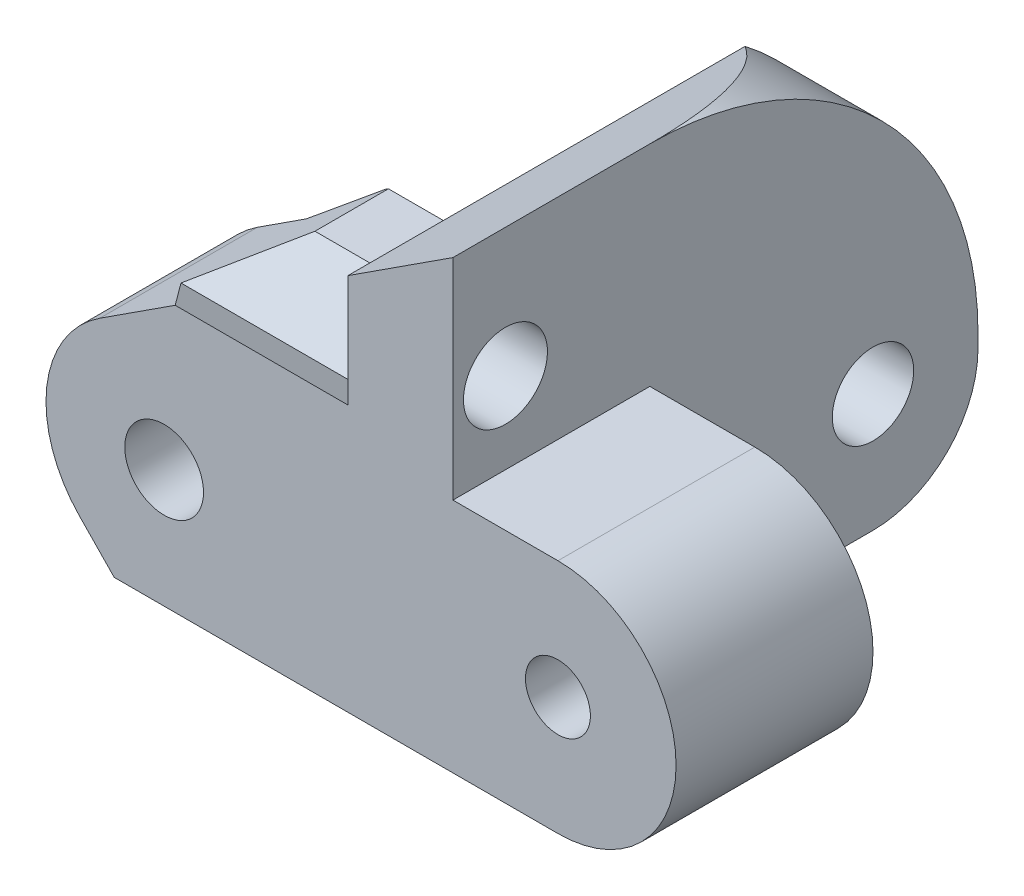
from build123d import *

# Parameters (mm, degrees)
SKETCH1_R           = 1.5
SKETCH1_R_2         = 1.236773622
BOSS_EXTRUDE1_DEPTH = 20
SKETCH3_R           = 1.6
CUT_EXTRUDE3_DEPTH  = 29.222331583
CUT_EXTRUDE4_DEPTH  = 14
CUT_EXTRUDE5_START  = -4
CUT_EXTRUDE5_DEPTH  = 25.222331583
SKETCH6_W           = 8.5
SKETCH6_H           = 9
SKETCH6_W_2         = 10
SKETCH6_H_2         = 10.541154273
CUT_EXTRUDE6_DEPTH  = 12.5
CHAMFER2_SIZE       = 2.5
CUT_EXTRUDE7_DEPTH  = 4.5
SKETCH8_R           = 1.55
CUT_EXTRUDE8_DEPTH  = 28.427176304
FILLET1_R           = 4
CHAMFER4_SIZE       = 1.8


with BuildPart() as part:
    # Sketch1 → Boss-Extrude1 (new body)
    with BuildSketch(Plane.XY):
        with BuildLine():
            Line((11, 12.5), (-2.4490752, 3.775186176))
            ThreePointArc((-2.4490752, 3.775186176), (-4.471750095, 0.503439255), (-3.227167472, -3.136142553))
            Line((-3.227167472, -3.136142553), (-1.901778748, -4.5))
            Line((-1.901778748, -4.5), (15, -4.5))
            ThreePointArc((15, -4.5), (19.5, 0), (15, 4.5))
            Line((15, 4.5), (11, 4.5))
            Line((11, 4.5), (11, 12.5))
        make_face()
        Circle(SKETCH1_R, mode=Mode.SUBTRACT)
        with Locations((15, 0)):
            Circle(SKETCH1_R_2, mode=Mode.SUBTRACT)
    extrude(amount=BOSS_EXTRUDE1_DEPTH)

    # Sketch3 → Cut-Extrude3 (cut, through all)
    with BuildSketch(Plane(origin=(11, 0, 0), x_dir=(0, 0, -1), z_dir=(1, 0, 0))):
        with Locations(Location((-18, 7.6, 0), (0, 0, 90))):
            Circle(SKETCH3_R)
    extrude(amount=-CUT_EXTRUDE3_DEPTH, mode=Mode.SUBTRACT)

    # Sketch4 → Cut-Extrude4 (cut)
    with BuildSketch(Plane(origin=(0, 0, 0), x_dir=(-1, 0, 0), z_dir=(0, 0, -1))):
        Polygon((1.58771324, 2.75), (1.58771324, 5.862379977), (6.597571209, 5.862379977), (6.597571209, -6.099785374), (1.58771324, -6.099785374), (1.58771324, -2.75), (-1.58771324, -2.75), (-3.175426481, 0), (-1.58771324, 2.75), align=None)
    extrude(amount=-CUT_EXTRUDE4_DEPTH, mode=Mode.SUBTRACT)

    # Sketch5 → Cut-Extrude5 (cut, through all)
    with BuildSketch(Plane(origin=(11, 0, 0), x_dir=(0, 0, -1), z_dir=(1, 0, 0)).offset(CUT_EXTRUDE5_START)):
        Polygon((-15.3, 6.041154273), (0, 6.041154273), (0, 11.349742261), (-20, 11.872391992), (-20, 5.637009085), (-18, 4.482308546), align=None)
    extrude(amount=-CUT_EXTRUDE5_DEPTH, mode=Mode.SUBTRACT)

    # Sketch6 → Cut-Extrude6 (cut)
    with BuildSketch(Plane(origin=(0, 0, 0), x_dir=(-1, 0, 0), z_dir=(0, 0, -1))):
        with Locations((-15.25, 0)):
            Rectangle(SKETCH6_W, SKETCH6_H)
        with Locations((-0.5, 0.770577137)):
            Rectangle(SKETCH6_W_2, SKETCH6_H_2)
    extrude(amount=-CUT_EXTRUDE6_DEPTH, mode=Mode.SUBTRACT)

    # Chamfer2
    # the kernel refuses this chamfer: 2.5 mm, written as the material it takes off along each edge
    with BuildSketch(Plane(origin=(-1.58771324, -10.92920747, 12.5), x_dir=(-0.027495876610586403, 0, 0.9996219169112968), z_dir=(0, 1, 0))) as chamfer2_piece_1_section:
        Polygon((CHAMFER2_SIZE * 0.999621916911, CHAMFER2_SIZE * 0.0274958766106), (-CHAMFER2_SIZE * 0.0274958766106, CHAMFER2_SIZE * 0.999621916911), (0, 0), align=None)
    chamfer2_piece_1 = extrude(amount=14.60841494, mode=Mode.PRIVATE)
    chamfer2_piece_1 = split(chamfer2_piece_1, bisect_by=Plane(origin=(-0.650189591, -3.625, 14), z_dir=(0, 0, -1)), keep=Keep.TOP, mode=Mode.PRIVATE)
    add(chamfer2_piece_1, mode=Mode.SUBTRACT)
    with BuildSketch(Plane(origin=(-1.58771324, -3.67920747, 12.5), x_dir=(-0.027495876610586403, 0, 0.9996219169112968), z_dir=(0, 1, 0))) as chamfer2_piece_2_section:
        Polygon((CHAMFER2_SIZE * 0.999621916911, CHAMFER2_SIZE * 0.0274958766106), (-CHAMFER2_SIZE * 0.0274958766106, CHAMFER2_SIZE * 0.999621916911), (0, 0), align=None)
    chamfer2_piece_2 = extrude(amount=14.442392157, mode=Mode.PRIVATE)
    chamfer2_piece_2 = split(chamfer2_piece_2, bisect_by=Plane(origin=(-0.650189591, 3.541988609, 14), z_dir=(0, 0, -1)), keep=Keep.TOP, mode=Mode.PRIVATE)
    add(chamfer2_piece_2, mode=Mode.SUBTRACT)

    # Sketch7 → Cut-Extrude7 (cut)
    with BuildSketch(Plane(origin=(0, 0, 12.5), x_dir=(-1, 0, 0), z_dir=(0, 0, -1))):
        Polygon((-12.2, -1.616580754), (-12.2, 1.616580754), (-15, 3.233161507), (-17.8, 1.616580754), (-17.8, -1.616580754), (-15, -3.233161507), align=None)
    extrude(amount=-CUT_EXTRUDE7_DEPTH, mode=Mode.SUBTRACT)

    # Sketch8 → Cut-Extrude8 (cut, through all)
    with BuildSketch(Plane.ZY.offset(-5.5)):
        with Locations(Location((4, 0, 0), (0, 0, 270))):
            Circle(SKETCH8_R)
        with BuildLine():
            Line((12.5, 12.5), (0, 12.5))
            Line((0, 12.5), (0, 0))
            ThreePointArc((0, 0), (3.661165235, 8.838834765), (12.5, 12.5))
        make_face()
    extrude(amount=-CUT_EXTRUDE8_DEPTH, mode=Mode.SUBTRACT)

    # Fillet1
    fillet1_edges = [part.edges().sort_by_distance(p)[0] for p in [
        (8.25, -4.5, 0),
    ]]
    fillet(fillet1_edges, radius=FILLET1_R)

    # Chamfer4
    chamfer4_edges = [part.edges().sort_by_distance(p)[0] for p in [
        (5.5, 1.55, 4),
    ]]
    chamfer(chamfer4_edges, length=CHAMFER4_SIZE)


solid = part.part
